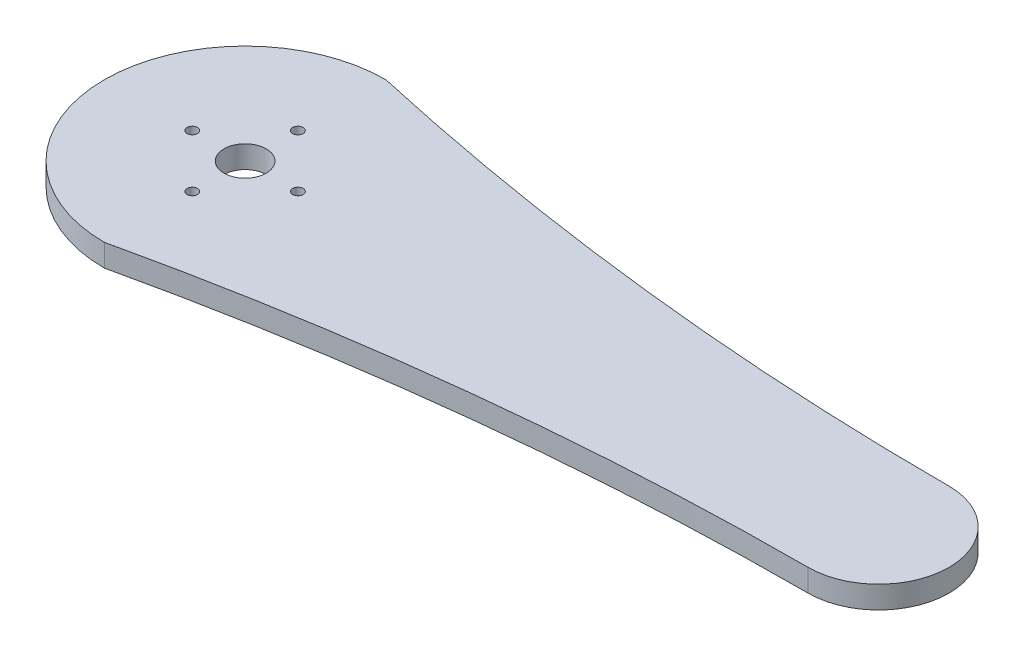
from build123d import *

# Parameters (mm, degrees)
SKETCH3_R           = 3
SKETCH3_R_2         = 0.75
BOSS_EXTRUDE1_DEPTH = 3.175


with BuildPart() as part:
    # Sketch3 → Boss-Extrude1 (new body)
    with BuildSketch(Plane(origin=(0, 0, 0), x_dir=(1, 0, 0), z_dir=(0, 1, 0))):
        with BuildLine():
            ThreePointArc((-40.372263643, 20), (-60.372263643, 0), (-40.372263643, -20))
            ThreePointArc((-40.372263643, -20), (4.350810667, -12.507668784), (49.627736357, -10))
            ThreePointArc((49.627736357, -10), (59.627736357, 0), (49.627736357, 10))
            ThreePointArc((49.627736357, 10), (4.350810667, 12.507668784), (-40.372263643, 20))
        make_face()
        with Locations((-40.372263643, 0)):
            Circle(SKETCH3_R, mode=Mode.SUBTRACT)
        with Locations((-32.872263643, 0)):
            Circle(SKETCH3_R_2, mode=Mode.SUBTRACT)
        with Locations((-47.872263643, 0)):
            Circle(SKETCH3_R_2, mode=Mode.SUBTRACT)
        with Locations((-40.372263643, 7.5)):
            Circle(SKETCH3_R_2, mode=Mode.SUBTRACT)
        with Locations((-40.372263643, -7.5)):
            Circle(SKETCH3_R_2, mode=Mode.SUBTRACT)
    extrude(amount=BOSS_EXTRUDE1_DEPTH)


solid = part.part
